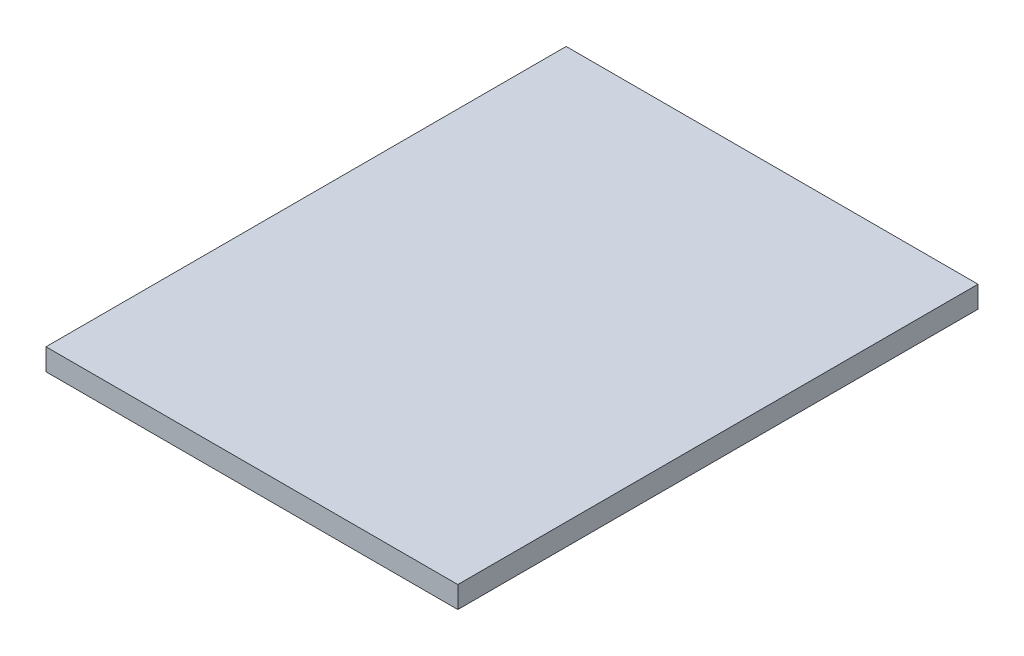
from build123d import *

# Parameters (mm, degrees)
SKETCH2_W           = 95
SKETCH2_H           = 120
BOSS_EXTRUDE1_DEPTH = 5


with BuildPart() as part:
    # Sketch2 → Boss-Extrude1 (new body)
    with BuildSketch(Plane(origin=(0, 0, 0), x_dir=(1, 0, 0), z_dir=(0, 1, 0))):
        Rectangle(SKETCH2_W, SKETCH2_H)
    extrude(amount=BOSS_EXTRUDE1_DEPTH)


solid = part.part
